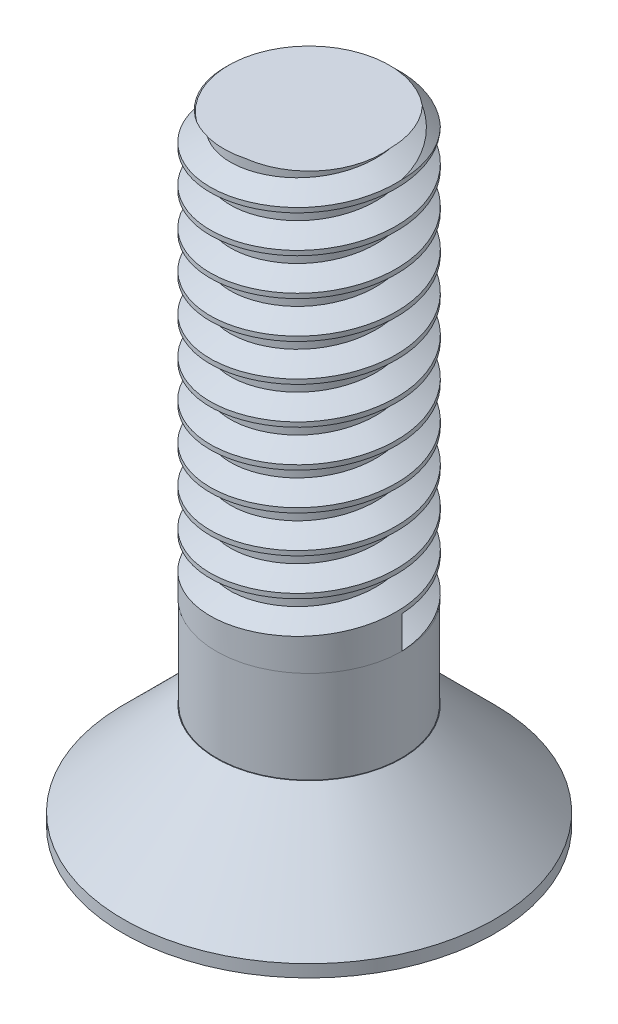
from build123d import *

# Parameters (mm, degrees)
CHAMFER1_SIZE   = 0.2
HEX_DEPTH_DEPTH = 1.2
SKETCH4_R       = 1
SKETCH3_R       = 1.154700538
THREAD_M3_PITCH = 0.6


with BuildPart() as part:
    # Sketch1 → Revolve1 (revolve)
    with BuildSketch(Plane.XY, mode=Mode.PRIVATE) as revolve1_sk:
        Polygon((0, -1.873883868), (-3, -1.873883868), (-3, -1.673883868), (-1.5, -0.173883868), (-1.49, -0.173883868), (-1.49, 1.326116132), (-1.5, 1.326116132), (-1.5, 8.126116132), (0, 8.126116132), align=None)
    revolve(revolve1_sk.sketch.rotate(Axis((0, 0, 0), (0, 1, 0)), 270), axis=Axis((0, 0, 0), (0, 1, 0)))

    # Chamfer1
    chamfer1_edges = [part.edges().sort_by_distance(p)[0] for p in [
        (0, 8.126116132, 1.5),
    ]]
    chamfer(chamfer1_edges, length=CHAMFER1_SIZE)

    # Sketch2 → hex depth (cut)
    with BuildSketch(Plane.XZ.offset(1.873883868)):
        Polygon((1.154700538, 0), (0.577350269, 1), (-0.577350269, 1), (-1.154700538, 0), (-0.577350269, -1), (0.577350269, -1), align=None)
    extrude(amount=-HEX_DEPTH_DEPTH, mode=Mode.SUBTRACT)

    # Sketch4 → hex corner cut section 0
    with BuildSketch(Plane(origin=(0, -1.673883868, 0), x_dir=(1, 0, 0), z_dir=(0, 1, 0))):
        Circle(SKETCH4_R)
    # Sketch3 → hex corner cut section 1
    with BuildSketch(Plane.XZ.offset(1.873883868)):
        Circle(SKETCH3_R)
    loft(mode=Mode.SUBTRACT)

    # thread M3: the profile of Thread Profile2 profile screwed along a right-hand helix of 11.333333 turns, 6 arcs to a turn; built about Z, then put on its axis
    thread_m3_z = Axis((0, 0, 0), (0, 0, 1))
    thread_m3_corners = [(1.5003, 0, -0.000173205), (1.5003, 0, 0.525173204), (1.175240475, 0, 0.337499999), (1.175240475, 0, 0.187499999)]
    with BuildLine(mode=Mode.PRIVATE) as thread_m3_profile:
        Line(thread_m3_corners[0], thread_m3_corners[1])
        Line(thread_m3_corners[1], thread_m3_corners[2])
        Line(thread_m3_corners[2], thread_m3_corners[3])
        Line(thread_m3_corners[3], thread_m3_corners[0])
    thread_m3_cap = Face(thread_m3_profile.wire())
    thread_m3_turn_angles = [0, 30, 60, 90, 120, 150, 180, 210, 240, 270, 300, 330, 360]
    thread_m3_turn_weights = [1, 0.8660254037844387, 1, 0.8660254037844387, 1, 0.8660254037844387, 1, 0.8660254037844387, 1, 0.8660254037844387, 1, 0.8660254037844387, 1]
    thread_m3_turn_rails = [Edge.make_bspline([Vector(p[0], p[1], 0).rotate(thread_m3_z, thread_m3_turn_angles[k]) / thread_m3_turn_weights[k] + Vector(0, 0, p[2] + THREAD_M3_PITCH * thread_m3_turn_angles[k] / 360) for k in range(13)], [0, 0, 0, 1, 1, 2, 2, 3, 3, 4, 4, 5, 5, 6, 6, 6], 2, thread_m3_turn_weights) for p in thread_m3_corners]
    thread_m3_turn_sides = [Face.make_surface_from_curves(thread_m3_turn_rails[p[0]], thread_m3_turn_rails[p[1]]) for p in [(0, 1), (1, 2), (2, 3), (3, 0)]]
    thread_m3_last_angles = [3960, 3990, 4020, 4050, 4080]
    thread_m3_last_weights = [1, 0.8660254037844387, 1, 0.8660254037844446, 1]
    thread_m3_last_rails = [Edge.make_bspline([Vector(p[0], p[1], 0).rotate(thread_m3_z, thread_m3_last_angles[k]) / thread_m3_last_weights[k] + Vector(0, 0, p[2] + THREAD_M3_PITCH * thread_m3_last_angles[k] / 360) for k in range(5)], [0, 0, 0, 1, 1, 2, 2, 2], 2, thread_m3_last_weights) for p in thread_m3_corners]
    thread_m3_last_sides = [Face.make_surface_from_curves(thread_m3_last_rails[p[0]], thread_m3_last_rails[p[1]]) for p in [(0, 1), (1, 2), (2, 3), (3, 0)]]
    thread_m3 = Plane(origin=(0, 1.326116132, 0), x_dir=(1, 0, 0), z_dir=(0, 1, 0)) * Solid(Shell([*[p.moved(Location((0, 0, THREAD_M3_PITCH * i))) for i in range(11) for p in thread_m3_turn_sides], *thread_m3_last_sides, thread_m3_cap, thread_m3_cap.rotate(thread_m3_z, 4080).moved(Location((0, 0, THREAD_M3_PITCH * 4080 / 360)))]))
    add(thread_m3, mode=Mode.SUBTRACT)


solid = part.part
